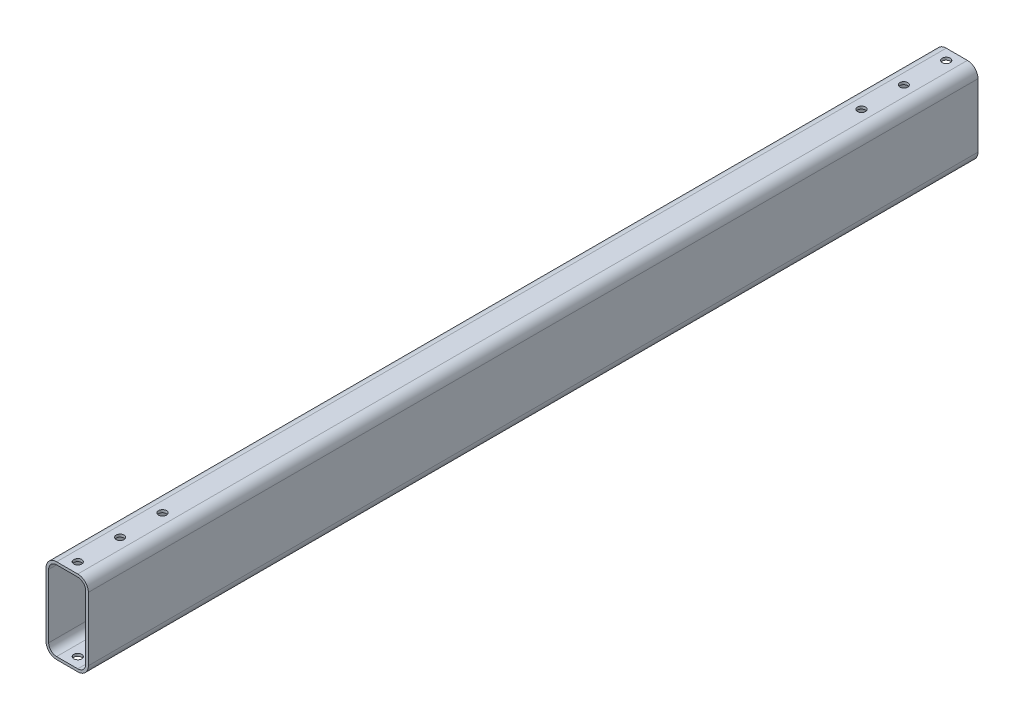
from build123d import *

# Parameters (mm, degrees)
EXTRUDE_THIN1_DEPTH            = 533.4
F_3_16_0_1875_DIAMETER_HOLE1_D = 4.7625


with BuildPart() as part:
    # Sketch1 → Extrude-Thin1 (new body)
    with BuildSketch(Plane.XY):
        with BuildLine():
            Line((-12.7, 19.05), (-12.7, -19.05))
            ThreePointArc((-12.7, -19.05), (-10.840128061, -23.540128061), (-6.35, -25.4))
            Line((-6.35, -25.4), (6.35, -25.4))
            ThreePointArc((6.35, -25.4), (10.840128061, -23.540128061), (12.7, -19.05))
            Line((12.7, -19.05), (12.7, 19.05))
            ThreePointArc((12.7, 19.05), (10.840128061, 23.540128061), (6.35, 25.4))
            Line((6.35, 25.4), (-6.35, 25.4))
            ThreePointArc((-6.35, 25.4), (-10.840128061, 23.540128061), (-12.7, 19.05))
        make_face()
        with BuildLine():
            Line((-11.1125, 19.05), (-11.1125, -19.05))
            ThreePointArc((-11.1125, -19.05), (-9.717596045, -22.417596045), (-6.35, -23.8125))
            Line((-6.35, -23.8125), (6.35, -23.8125))
            ThreePointArc((6.35, -23.8125), (9.717596045, -22.417596045), (11.1125, -19.05))
            Line((11.1125, -19.05), (11.1125, 19.05))
            ThreePointArc((11.1125, 19.05), (9.717596045, 22.417596045), (6.35, 23.8125))
            Line((6.35, 23.8125), (-6.35, 23.8125))
            ThreePointArc((-6.35, 23.8125), (-9.717596045, 22.417596045), (-11.1125, 19.05))
        make_face(mode=Mode.SUBTRACT)
    extrude(amount=EXTRUDE_THIN1_DEPTH)

    # 3/16 (0.1875) Diameter Hole1 (through all)
    with Locations(Plane(origin=(0, 25.4, 527.05), x_dir=(0, 0, 1), z_dir=(0, 1, 0))):
        with Locations((0, 0), (-520.7, 0), (-495.3, 0), (-469.9, 0), (-25.4, 0), (-50.8, 0)):
            Hole(F_3_16_0_1875_DIAMETER_HOLE1_D / 2)


solid = part.part
